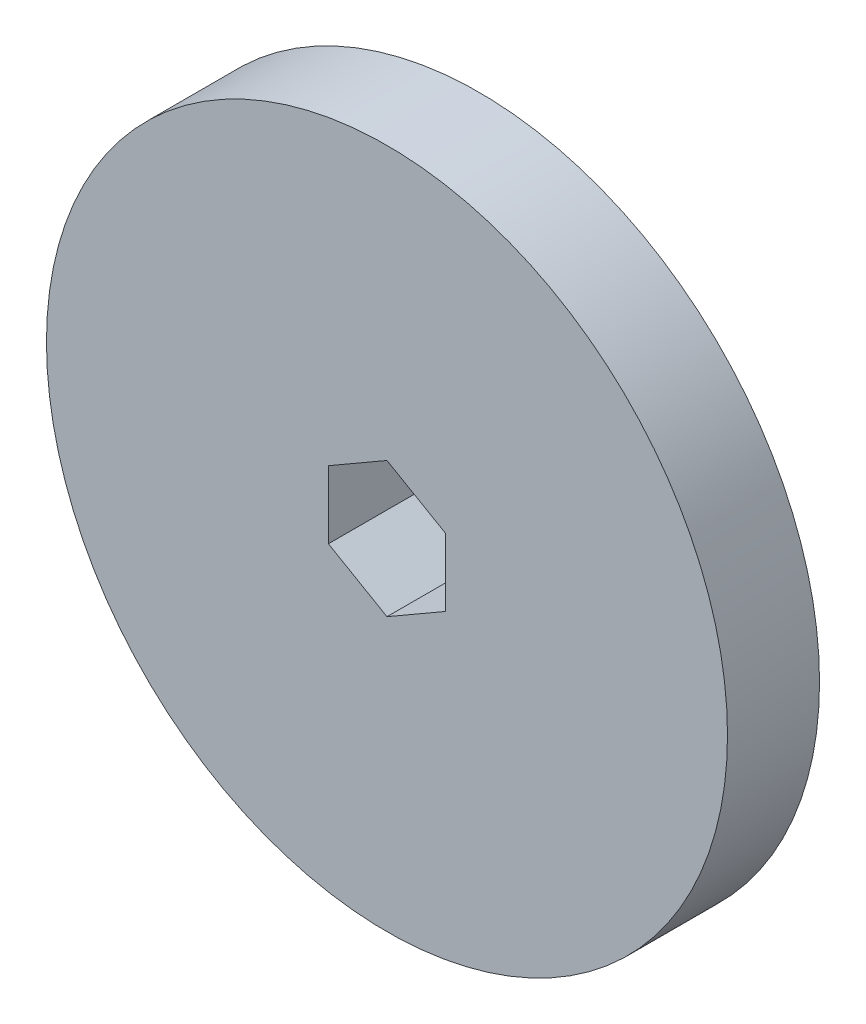
from build123d import *

# Parameters (mm, degrees)
SKETCH1_R           = 37
BOSS_EXTRUDE2_DEPTH = 10
CUT_EXTRUDE1_DEPTH  = 10


with BuildPart() as part:
    # Sketch1 → Boss-Extrude2 (new body)
    with BuildSketch(Plane.XY):
        Circle(SKETCH1_R)
    extrude(amount=BOSS_EXTRUDE2_DEPTH)

    # Sketch2 → Cut-Extrude1 (cut)
    with BuildSketch(Plane.XY.offset(10)):
        Polygon((0, 7.349668927), (-6.365, 3.674834463), (-6.365, -3.674834463), (0, -7.349668927), (6.365, -3.674834463), (6.365, 3.674834463), align=None)
    extrude(amount=-CUT_EXTRUDE1_DEPTH, mode=Mode.SUBTRACT)


solid = part.part
